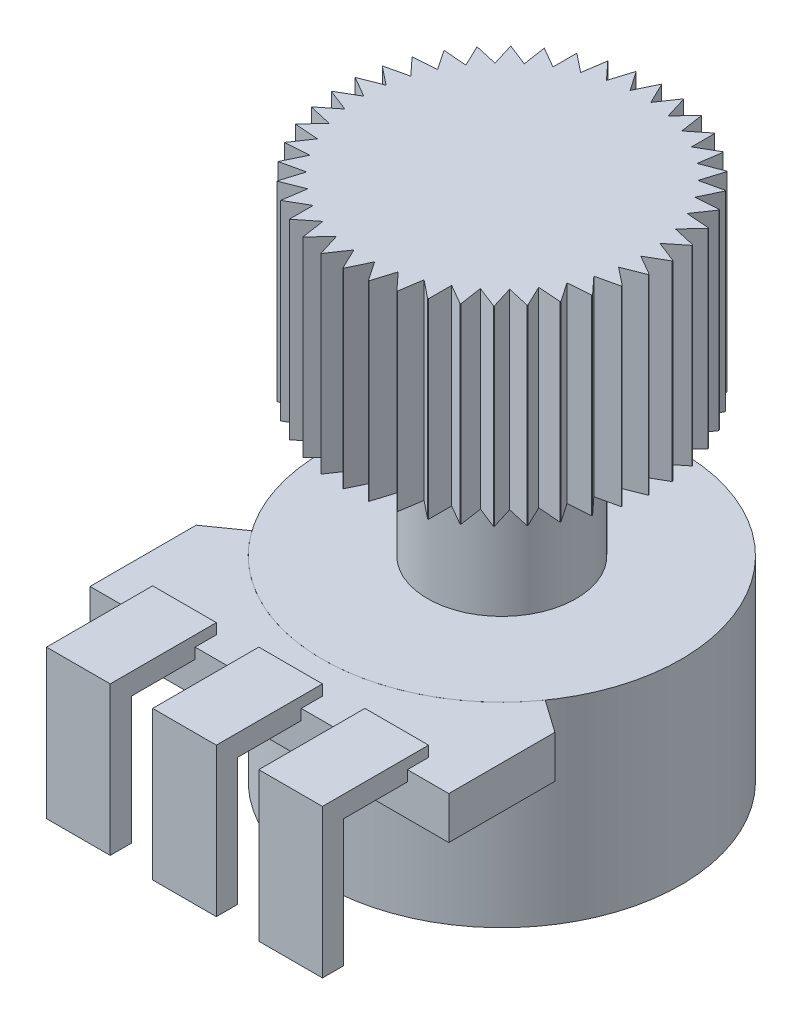
from build123d import *

# Parameters (mm, degrees)
SKETCH1_R           = 8.45
BOSS_EXTRUDE1_DEPTH = 9.2
BOSS_EXTRUDE2_START = 7.2
SKETCH1_3_W         = 3
SKETCH1_3_H         = 1
BOSS_EXTRUDE2_DEPTH = 2
BOSS_EXTRUDE3_START = 8.7
SKETCH1_4_W         = 3
SKETCH1_4_H         = 1
SKETCH1_4_H_2       = 4
BOSS_EXTRUDE3_DEPTH = 1
SKETCH5_R           = 3
BOSS_EXTRUDE4_DEPTH = 6.5
SKETCH6_W           = 3
SKETCH6_H           = 1
BOSS_EXTRUDE5_DEPTH = 6
CUT_EXTRUDE2_DEPTH  = 9
CIRPATTERN2_COUNT   = 42


# Read off the part's stored shape, not the designer's step: M7x1.0 Machine Threads Stud1
with BuildPart() as part:
    # Sketch1 → Boss-Extrude1 (new body)
    with BuildSketch(Plane(origin=(0, 0, 0), x_dir=(1, 0, 0), z_dir=(0, 1, 0))):
        with Locations(Location((0, 0, 0), (0, 0, 270))):
            Circle(SKETCH1_R)
    extrude(amount=BOSS_EXTRUDE1_DEPTH)

    # M7x1.0 Machine Threads Stud1 outline → M7x1.0 Machine Threads Stud1 (revolve)
    with BuildSketch(Plane.XY):
        Polygon((2.9455, 15.7), (0, 15.7), (0, 9.2), (3.5, 9.2), (3.5, 15.1455), align=None)
    revolve(axis=Axis((0, 0, 0), (0, 1, 0)))

    # Sketch5 → Boss-Extrude4 (add)
    with BuildSketch(Plane(origin=(0, 15.7, 0), x_dir=(1, 0, 0), z_dir=(0, 1, 0))):
        with Locations(Location((0, 0, 0), (0, 0, 90))):
            Circle(SKETCH5_R)
    extrude(amount=BOSS_EXTRUDE4_DEPTH)


with BuildPart() as body_2:
    # Sketch1<3> → Boss-Extrude2 (new body)
    with BuildSketch(Plane(origin=(0, 0, 0), x_dir=(1, 0, 0), z_dir=(0, 1, 0)).offset(BOSS_EXTRUDE2_START)):
        with BuildLine():
            Line((-6.909038706, -4.864944414), (-8.45, -5.95))
            Line((-8.45, -5.95), (-6, -5.95))
            ThreePointArc((-6, -5.95), (-6.477280022, -5.426540658), (-6.909038706, -4.864944414))
        make_face()
        with BuildLine():
            Line((-6, -5.95), (-8.45, -5.95))
            Line((-8.45, -5.95), (-8.45, -10.95))
            Line((-8.45, -10.95), (-6.5, -10.95))
            Line((-6.5, -10.95), (-6.5, -9.95))
            Line((-6.5, -9.95), (-3.5, -9.95))
            Line((-3.5, -9.95), (-3.5, -10.95))
            Line((-3.5, -10.95), (-1.5, -10.95))
            Line((-1.5, -10.95), (-1.5, -9.95))
            Line((-1.5, -9.95), (1.5, -9.95))
            Line((1.5, -9.95), (1.5, -10.95))
            Line((1.5, -10.95), (3.5, -10.95))
            Line((3.5, -10.95), (3.5, -9.95))
            Line((3.5, -9.95), (6.5, -9.95))
            Line((6.5, -9.95), (6.5, -10.95))
            Line((6.5, -10.95), (8.45, -10.95))
            Line((8.45, -10.95), (8.45, -5.95))
            Line((8.45, -5.95), (6, -5.95))
            ThreePointArc((6, -5.95), (0, -8.45), (-6, -5.95))
        make_face()
        with BuildLine():
            ThreePointArc((6.909038706, -4.864944414), (6.477280022, -5.426540658), (6, -5.95))
            Line((6, -5.95), (8.45, -5.95))
            Line((8.45, -5.95), (6.909038706, -4.864944414))
        make_face()
        with Locations((-5, -10.45)):
            Rectangle(SKETCH1_3_W, SKETCH1_3_H)
        with Locations((0, -10.45)):
            Rectangle(SKETCH1_3_W, SKETCH1_3_H)
        with Locations((5, -10.45)):
            Rectangle(SKETCH1_3_W, SKETCH1_3_H)
    extrude(amount=BOSS_EXTRUDE2_DEPTH)


with BuildPart() as body_3:
    # Sketch1<4> → Boss-Extrude3 (new body)
    with BuildSketch(Plane(origin=(0, 0, 0), x_dir=(1, 0, 0), z_dir=(0, 1, 0)).offset(BOSS_EXTRUDE3_START)):
        with Locations((-5, -10.45)):
            Rectangle(SKETCH1_4_W, SKETCH1_4_H)
        with Locations((-5, -12.95)):
            Rectangle(SKETCH1_4_W, SKETCH1_4_H_2)
        with Locations((0, -10.45)):
            Rectangle(SKETCH1_4_W, SKETCH1_4_H)
        with Locations((0, -12.95)):
            Rectangle(SKETCH1_4_W, SKETCH1_4_H_2)
        with Locations((5, -10.45)):
            Rectangle(SKETCH1_4_W, SKETCH1_4_H)
        with Locations((5, -12.95)):
            Rectangle(SKETCH1_4_W, SKETCH1_4_H_2)
    extrude(amount=BOSS_EXTRUDE3_DEPTH)

    # Sketch6 → Boss-Extrude5 (add)
    with BuildSketch(Plane.XZ.offset(-8.7)):
        with Locations((-5, 14.45)):
            Rectangle(SKETCH6_W, SKETCH6_H)
        with Locations((0, 14.45)):
            Rectangle(SKETCH6_W, SKETCH6_H)
        with Locations((5, 14.45)):
            Rectangle(SKETCH6_W, SKETCH6_H)
    extrude(amount=BOSS_EXTRUDE5_DEPTH)


with BuildPart() as body_4:
    # Sketch8 → Revolve1 (revolve)
    with BuildSketch(Plane.XY, mode=Mode.PRIVATE) as revolve1_sk:
        Polygon((-7.5, 15.7), (-3, 15.7), (-3, 22.2), (0, 22.2), (0, 24.7), (-7.5, 24.7), align=None)
    revolve(revolve1_sk.sketch.rotate(Axis((0, 22.2, 0), (0, 1, 0)), 180), axis=Axis((0, 22.2, 0), (0, 1, 0)))

    # Sketch9 → Cut-Extrude2 (cut)
    with BuildSketch(Plane(origin=(0, 24.7, 0), x_dir=(1, 0, 0), z_dir=(0, 1, 0))):
        Polygon((-6.5, 0), (-8, 0.866025404), (-8, -0.866025404), align=None)
    cut_extrude2 = extrude(amount=-CUT_EXTRUDE2_DEPTH, mode=Mode.SUBTRACT)

    # CirPattern2: Cut-Extrude2 ×42 about axis
    cirpattern2_axis = Axis((0.023137555, 0, 0), (0, 1, 0))
    for i in range(1, CIRPATTERN2_COUNT):
        add(cut_extrude2.rotate(cirpattern2_axis, i * 360 / CIRPATTERN2_COUNT), mode=Mode.SUBTRACT)


solid = Compound([part.part, body_2.part, body_3.part, body_4.part])
